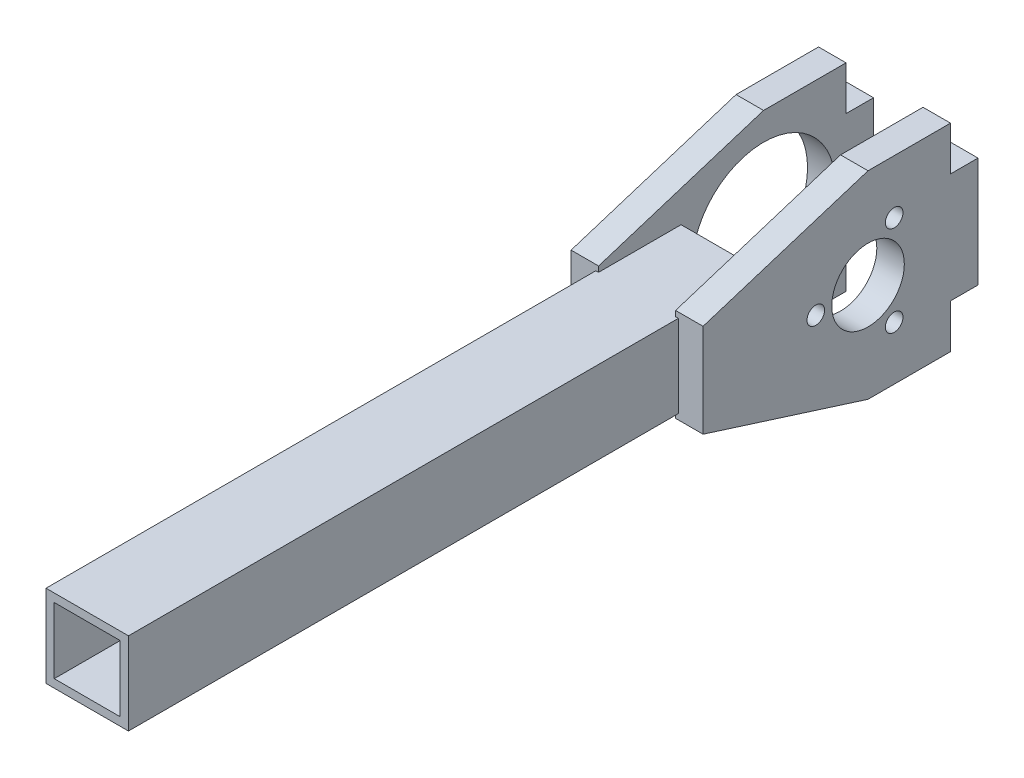
from build123d import *

# Parameters (mm, degrees)
SKETCH_3_R           = 6.6
SKETCH_3_R_2         = 1.6
EXTRUDE_1_DEPTH      = 5
SKETCH_5_R           = 13
EXTRUDE_2_DEPTH      = 5
EXTRUDE_3_DEPTH      = 100
EXTRUDE_3_DEPTH_BACK = 15
SKETCH_6_W           = 15
SKETCH_6_H           = 15
SKETCH_6_W_2         = 12
SKETCH_6_H_2         = 12


with BuildPart() as part:
    # ｽｹｯﾁ3 → ﾎﾞｽ - 押し出し1 (new body)
    with BuildSketch(Plane(origin=(7, 0, 0), x_dir=(0, 0, -1), z_dir=(1, 0, 0))):
        Polygon((5, 10), (5, -10), (0, -10), (0, -18), (-15, -18), (-45, -8.5), (-45, 8.5), (-15, 18), (0, 18), (0, 10), align=None)
        with Locations((-15, 0)):
            Circle(SKETCH_3_R, mode=Mode.SUBTRACT)
        with Locations((-24.5, 0)):
            Circle(SKETCH_3_R_2, mode=Mode.SUBTRACT)
        with Locations((-10.25, 8.227241336)):
            Circle(SKETCH_3_R_2, mode=Mode.SUBTRACT)
        with Locations((-10.25, -8.227241336)):
            Circle(SKETCH_3_R_2, mode=Mode.SUBTRACT)
    extrude(amount=EXTRUDE_1_DEPTH)



with BuildPart() as body_2:
    # ｽｹｯﾁ5 → ﾎﾞｽ - 押し出し2 (new body)
    with BuildSketch(Plane(origin=(-7, 0, 0), x_dir=(0, 0, -1), z_dir=(1, 0, 0))):
        Polygon((-45, -8.5), (-45, 8.5), (-15, 18), (0, 18), (0, 10), (5, 10), (5, -10), (0, -10), (0, -18), (-15, -18), align=None)
        with Locations((-15, 0)):
            Circle(SKETCH_5_R, mode=Mode.SUBTRACT)
    extrude(amount=-EXTRUDE_2_DEPTH)


with BuildPart() as part_1:
    add(part.part)

    add(body_2.part)  # ﾎﾞｽ - 押し出し3 merges body 2
    # ｽｹｯﾁ6 → ﾎﾞｽ - 押し出し3 (add, two sides: drawn at the far end of the back side and taken through both)
    with BuildSketch(Plane.XY.offset(45).offset(-EXTRUDE_3_DEPTH_BACK)):
        Rectangle(SKETCH_6_W, SKETCH_6_H)
        Rectangle(SKETCH_6_W_2, SKETCH_6_H_2, mode=Mode.SUBTRACT)
    extrude(amount=EXTRUDE_3_DEPTH + EXTRUDE_3_DEPTH_BACK)


solid = part_1.part
